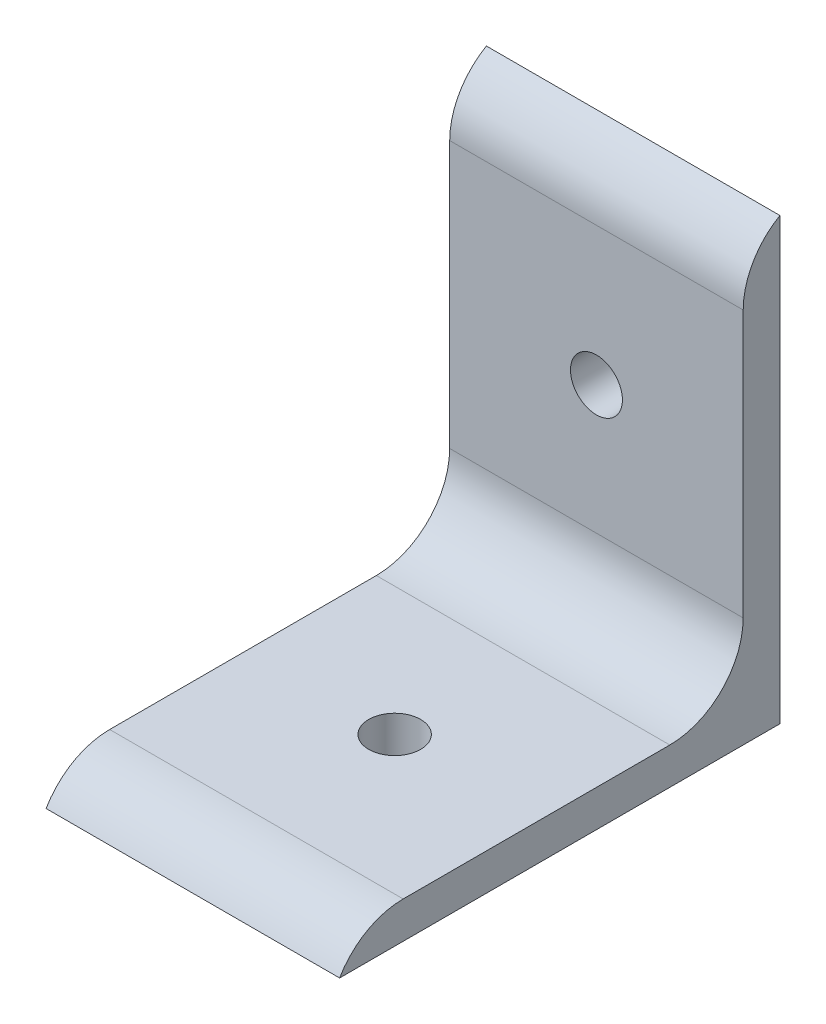
from build123d import *

# Parameters (mm, degrees)
BOSS_EXTRUDE1_DEPTH   = 25.4
FILLET1_R             = 6.35
F_8_CLEARANCE_HOLE1_D = 4.4958
F_8_CLEARANCE_HOLE2_D = 4.4958


with BuildPart() as part:
    # Sketch1 → Boss-Extrude1 (new body)
    with BuildSketch(Plane(origin=(0, 0, 0), x_dir=(0, 0, -1), z_dir=(1, 0, 0))):
        Polygon((0, 0), (0, 38.1), (-3.175, 38.1), (-3.175, 3.175), (-38.1, 3.175), (-38.1, 0), align=None)
    extrude(amount=BOSS_EXTRUDE1_DEPTH)

    # Fillet1
    # the kernel refuses this fillet: 6.35 mm, written as the material it adds along each edge
    with BuildSketch(Plane(origin=(0, 3.175, 3.175), x_dir=(0, 1, 0), z_dir=(1, 0, 0))) as fillet1_piece_1:
        with BuildLine():
            CenterArc((FILLET1_R, FILLET1_R), FILLET1_R, 180, 90)
            Line((0, FILLET1_R), (0, 0))
            Line((0, 0), (FILLET1_R, 0))
        make_face()
    extrude(amount=25.4)
    # the kernel refuses this fillet: 6.35 mm, written as the material it takes off along each edge
    with BuildSketch(Plane(origin=(-13.748153285, 38.1, 3.175), x_dir=(0, 0, -1), z_dir=(1, 0, 0))) as fillet1_2_piece_1:
        with BuildLine():
            CenterArc((6.35, -5.499261314), FILLET1_R, 120, 60)
            Line((0, -5.499261314), (0, 0))
            Line((0, 0), (3.175, 0))
        make_face()
    extrude(amount=52.89630657, mode=Mode.SUBTRACT)
    with BuildSketch(Plane(origin=(-13.748153285, 3.175, 38.1), x_dir=(0, -1, 0), z_dir=(1, 0, 0))) as fillet1_2_piece_2:
        with BuildLine():
            CenterArc((6.35, 5.499261314), FILLET1_R, 180, 60)
            Line((0, 5.499261314), (0, 0))
            Line((0, 0), (3.175, 0))
        make_face()
    extrude(amount=52.89630657, mode=Mode.SUBTRACT)

    # #8 Clearance Hole1 (through all)
    with Locations(Plane.XY.offset(3.175)):
        with Locations((12.7, 20.6375)):
            Hole(F_8_CLEARANCE_HOLE1_D / 2)

    # #8 Clearance Hole2 (through all)
    with Locations(Plane(origin=(0, 3.175, 0), x_dir=(1, 0, 0), z_dir=(0, 1, 0))):
        with Locations((12.7, -20.6375)):
            Hole(F_8_CLEARANCE_HOLE2_D / 2)


solid = part.part
